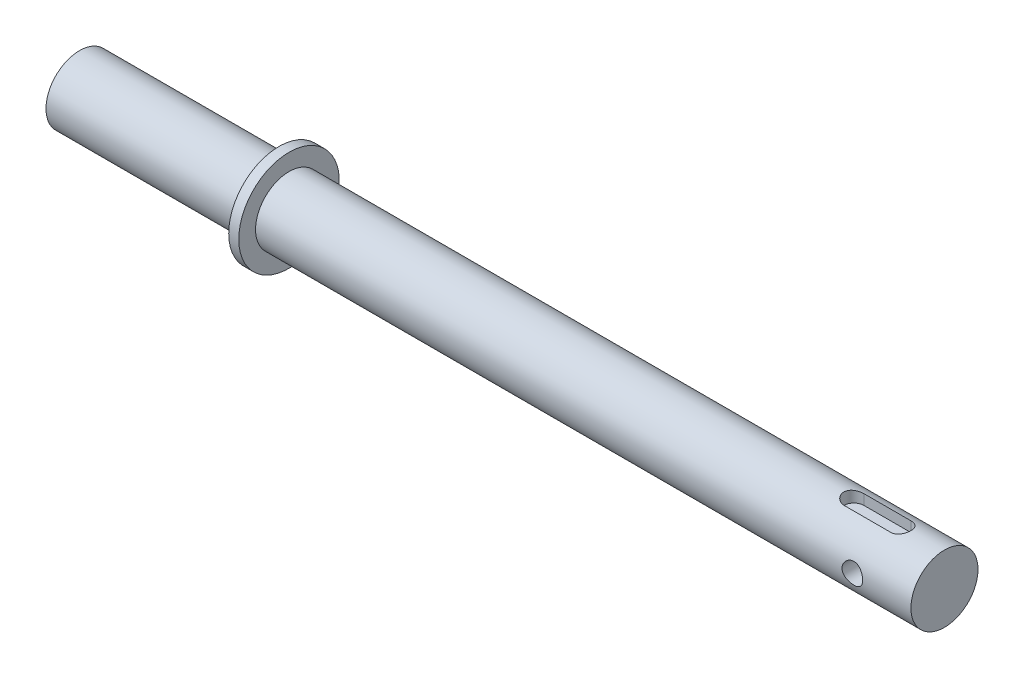
from build123d import *

# Parameters (mm, degrees)
SALIENTE_EXTRUIR1_START           = 8
CROQUIS1_R                        = 10
SALIENTE_EXTRUIR1_DEPTH           = 258
CROQUIS2_R                        = 15
SALIENTE_EXTRUIR2_DEPTH           = 3
CORTAR_EXTRUIR1_REACH             = 268.845
CROQUIS3_R                        = 3.075
CORTAR_EXTRUIR1_DIRECTION_2_REACH = 268.845
CORTAR_EXTRUIR2_START             = 10
CORTAR_EXTRUIR2_DEPTH             = 3.5


with BuildPart() as part:
    # Croquis1 → Saliente-Extruir1 (new body)
    with BuildSketch(Plane(origin=(0, 0, 0), x_dir=(0, 0, -1), z_dir=(1, 0, 0)).offset(SALIENTE_EXTRUIR1_START)):
        Circle(CROQUIS1_R)
    extrude(amount=SALIENTE_EXTRUIR1_DEPTH)

    # Croquis2 → Saliente-Extruir2 (add)
    with BuildSketch(Plane.ZY.offset(-70.5)):
        Circle(CROQUIS2_R)
    extrude(amount=SALIENTE_EXTRUIR2_DEPTH)

    # Croquis3 → Cortar-Extruir1 (cut, up to next)
    with BuildSketch(Plane.XY, mode=Mode.PRIVATE) as cortar_extruir1_sk1:
        with Locations((248.5, 0)):
            Circle(CROQUIS3_R)
    cortar_extruir1_tool1 = extrude(cortar_extruir1_sk1.sketch, amount=-CORTAR_EXTRUIR1_REACH, mode=Mode.PRIVATE) & part.part
    add(cortar_extruir1_tool1.solids().sort_by_distance((248.5, 0, 0))[0], mode=Mode.SUBTRACT)

    # Croquis3 → Cortar-Extruir1 direction 2 (cut, up to next)
    with BuildSketch(Plane.XY, mode=Mode.PRIVATE) as cortar_extruir1_direction_2_sk1:
        with Locations((248.5, 0)):
            Circle(CROQUIS3_R)
    cortar_extruir1_direction_2_tool1 = extrude(cortar_extruir1_direction_2_sk1.sketch, amount=CORTAR_EXTRUIR1_DIRECTION_2_REACH, mode=Mode.PRIVATE) & part.part
    add(cortar_extruir1_direction_2_tool1.solids().sort_by_distance((248.5, 0, 0))[0], mode=Mode.SUBTRACT)

    # Croquis4 → Cortar-Extruir2 (cut)
    with BuildSketch(Plane(origin=(0, 0, 0), x_dir=(1, 0, 0), z_dir=(0, 1, 0)).offset(CORTAR_EXTRUIR2_START)):
        with BuildLine():
            Line((239, 3), (253, 3))
            ThreePointArc((253, 3), (256, 0), (253, -3))
            Line((253, -3), (239, -3))
            ThreePointArc((239, -3), (236, 0), (239, 3))
        make_face()
    extrude(amount=-CORTAR_EXTRUIR2_DEPTH, mode=Mode.SUBTRACT)


solid = part.part
